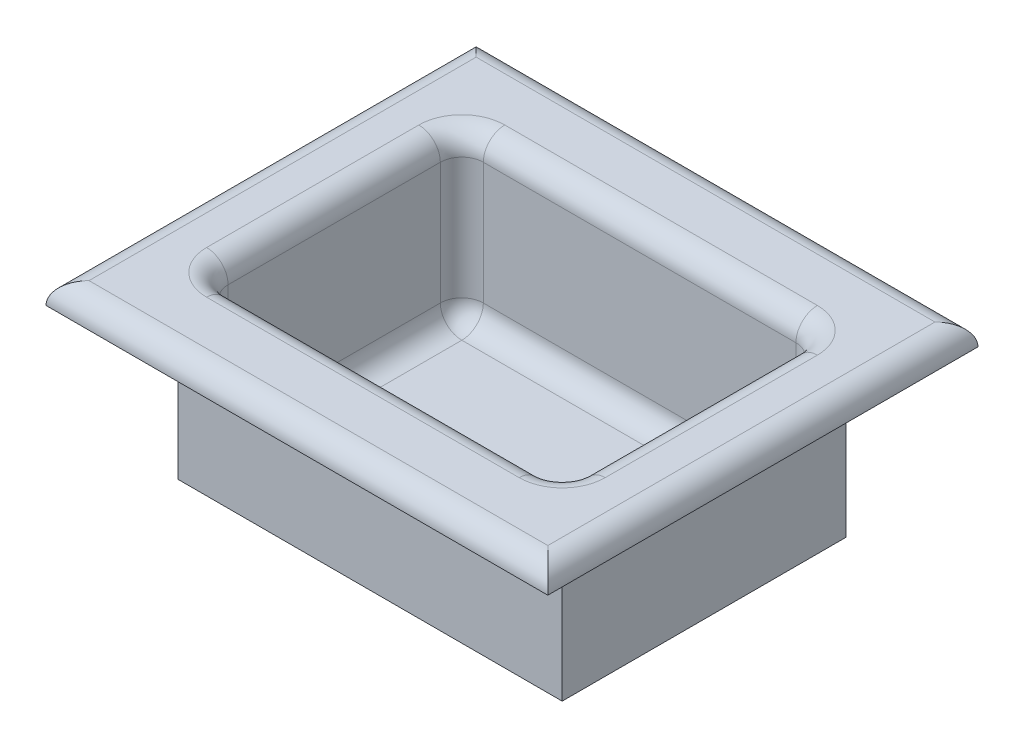
from build123d import *

# Parameters (mm, degrees)
SKETCH1_W           = 53.6
SKETCH1_H           = 39.6
BOSS_EXTRUDE1_DEPTH = 2
SKETCH2_W           = 53.6
SKETCH2_H           = 39.6
SKETCH2_W_2         = 49.6
SKETCH2_H_2         = 35.6
BOSS_EXTRUDE2_DEPTH = 20
SKETCH3_W           = 70
SKETCH3_H           = 60
SKETCH3_W_2         = 49.6
SKETCH3_H_2         = 35.6
BOSS_EXTRUDE3_DEPTH = 3
FILLET1_R           = 3


with BuildPart() as part:
    # Sketch1 → Boss-Extrude1 (new body)
    with BuildSketch(Plane(origin=(0, 0, 0), x_dir=(1, 0, 0), z_dir=(0, 1, 0))):
        Rectangle(SKETCH1_W, SKETCH1_H)
    extrude(amount=BOSS_EXTRUDE1_DEPTH)

    # Sketch2 → Boss-Extrude2 (add)
    with BuildSketch(Plane(origin=(0, 2, 0), x_dir=(1, 0, 0), z_dir=(0, 1, 0))):
        Rectangle(SKETCH2_W, SKETCH2_H)
        Rectangle(SKETCH2_W_2, SKETCH2_H_2, mode=Mode.SUBTRACT)
    extrude(amount=BOSS_EXTRUDE2_DEPTH)

    # Sketch3 → Boss-Extrude3 (add)
    with BuildSketch(Plane(origin=(0, 22, 0), x_dir=(1, 0, 0), z_dir=(0, 1, 0))):
        Rectangle(SKETCH3_W, SKETCH3_H)
        Rectangle(SKETCH3_W_2, SKETCH3_H_2, mode=Mode.SUBTRACT)
    extrude(amount=BOSS_EXTRUDE3_DEPTH)

    # Fillet1
    fillet1_edges = [part.edges().sort_by_distance(p)[0] for p in [
        (24.8, 13.5, 17.8),
        (0, 25, 17.8),
        (-24.8, 13.5, 17.8),
        (0, 2, 17.8),
        (24.8, 13.5, -17.8),
        (-24.8, 13.5, -17.8),
        (24.8, 2, 0),
        (-24.8, 2, 0),
        (0, 2, -17.8),
        (24.8, 25, 0),
        (0, 25, -17.8),
        (-24.8, 25, 0),
        (0, 25, 30),
        (0, 25, -30),
        (35, 25, 0),
        (-35, 25, 0),
    ]]
    fillet(fillet1_edges, radius=FILLET1_R - 0.0001)  # a hair under: the kernel refuses the full size


solid = part.part
